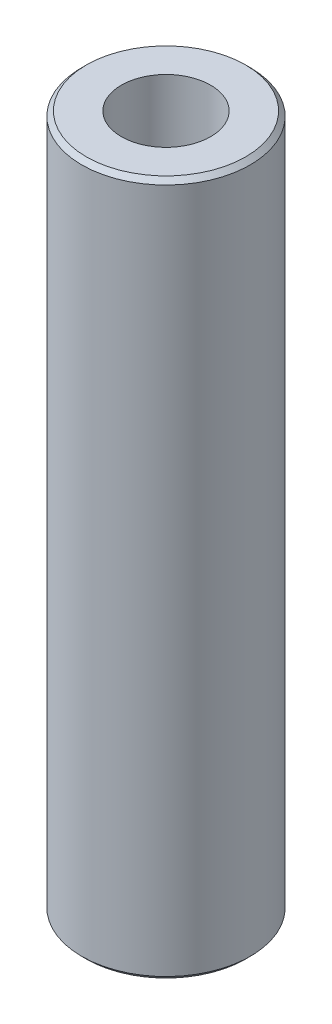
from build123d import *

# Parameters (mm, degrees)
SKETCH1_R           = 30
BOSS_EXTRUDE1_DEPTH = 247.30197147
SKETCH2_R           = 15.903382893
CUT_EXTRUDE1_DEPTH  = 251.914856262
CHAMFER1_SIZE       = 1.647337006


with BuildPart() as part:
    # Sketch1 → Boss-Extrude1 (new body)
    with BuildSketch(Plane(origin=(0, 0, 0), x_dir=(1, 0, 0), z_dir=(0, 1, 0))):
        Circle(SKETCH1_R)
    extrude(amount=BOSS_EXTRUDE1_DEPTH)

    # Sketch2 → Cut-Extrude1 (cut, through all)
    with BuildSketch(Plane(origin=(0, 0, 0), x_dir=(1, 0, 0), z_dir=(0, 1, 0))):
        Circle(SKETCH2_R)
    extrude(amount=CUT_EXTRUDE1_DEPTH, mode=Mode.SUBTRACT)

    # Chamfer1
    chamfer1_edges = [part.edges().sort_by_distance(p)[0] for p in [
        (-30, 247.30197147, 0),
        (-30, 0, 0),
    ]]
    chamfer(chamfer1_edges, length=CHAMFER1_SIZE)


solid = part.part
